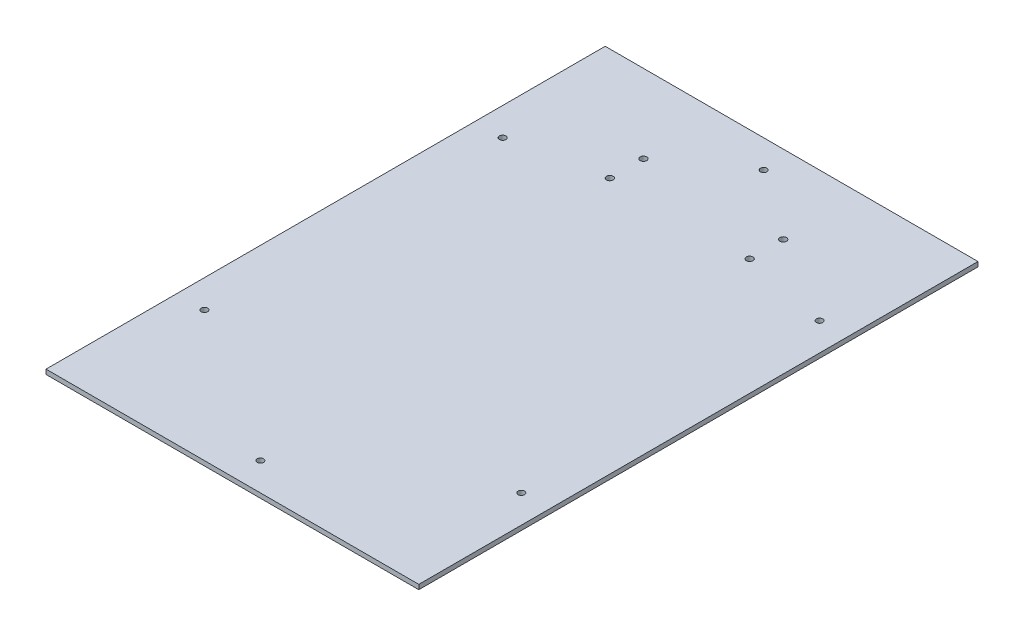
from build123d import *

# Parameters (mm, degrees)
SKETCH1_W                        = 254
SKETCH1_H                        = 381
BOSS_EXTRUDE1_DEPTH              = 3.175
F_16_0_177_DIAMETER_HOLE1_D      = 4.4958
F_11_64_0_17188_DIAMETER_HOLE1_D = 4.365752


with BuildPart() as part:
    # Sketch1 → Boss-Extrude1 (new body)
    with BuildSketch(Plane(origin=(0, 0, 0), x_dir=(1, 0, 0), z_dir=(0, 1, 0))):
        with Locations((-21.925369934, 40.334323398)):
            Rectangle(SKETCH1_W, SKETCH1_H)
    extrude(amount=BOSS_EXTRUDE1_DEPTH)

    # #16 (0.177) Diameter Hole1 (through all)
    with Locations(Plane(origin=(0, 0, 0), x_dir=(-1, 0, 0), z_dir=(0, -1, 0))):
        with Locations((-25.699630066, 177.494323398), (-25.699630066, 154.634323398), (69.550369934, 154.634323398), (69.550369934, 177.494323398)):
            Hole(F_16_0_177_DIAMETER_HOLE1_D / 2)

    # 11/64 (0.17188) Diameter Hole1 (through all)
    with Locations(Plane(origin=(0, 0, 0), x_dir=(-1, 0, 0), z_dir=(0, -1, 0))):
        with Locations((-86.024630066, 141.934323398), (21.925369934, 211.784323398), (129.875369934, 141.934323398), (129.875369934, -61.265676602), (21.925369934, -131.115676602), (-86.024630066, -61.265676602)):
            Hole(F_11_64_0_17188_DIAMETER_HOLE1_D / 2)


solid = part.part
